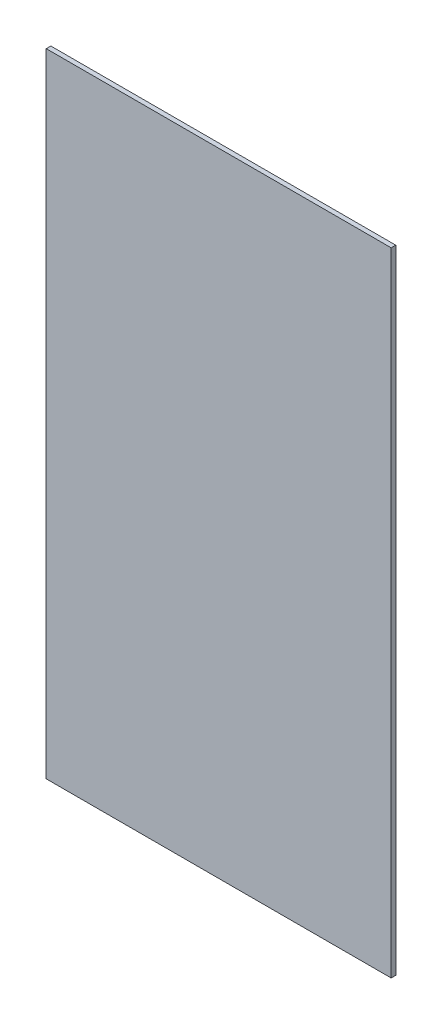
from build123d import *

# Parameters (mm, degrees)
SKETCH1_W           = 60
SKETCH1_H           = 110
BOSS_EXTRUDE1_DEPTH = 0.8


with BuildPart() as part:
    # Sketch1 → Boss-Extrude1 (new body)
    with BuildSketch(Plane.XY):
        with Locations((-0.526246777, 22.260428534)):
            Rectangle(SKETCH1_W, SKETCH1_H)
    extrude(amount=BOSS_EXTRUDE1_DEPTH)


solid = part.part
